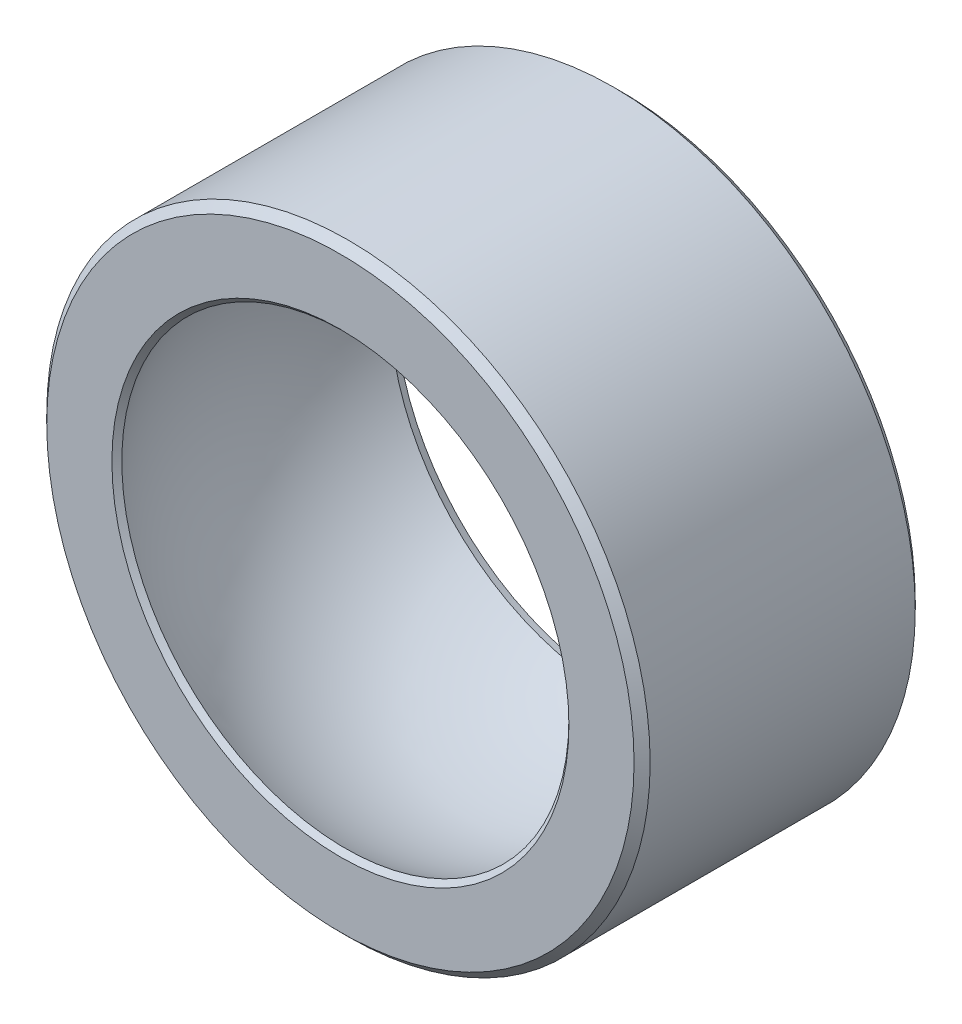
from build123d import *

# Parameters (mm, degrees)
ESTRUSIONE1_DEPTH      = 3.495
ESTRUSIONE1_DEPTH_BACK = 3.495
SCHIZZO1_R             = 7.5
SMUSSO1_SIZE           = 0.2
SMUSSO1_SIZE_2         = 0.14484006


with BuildPart() as part:
    # Schizzo1 → Estrusione1 (new, two sides: drawn at the far end of the back side and taken through both)
    with BuildSketch(Plane.XY.offset(-ESTRUSIONE1_DEPTH_BACK)):
        Circle(SCHIZZO1_R)
    extrude(amount=ESTRUSIONE1_DEPTH + ESTRUSIONE1_DEPTH_BACK)

    # Schizzo2 → Taglia-Rivoluzione1 (revolve, cut)
    with BuildSketch(Plane(origin=(0, 0, 0), x_dir=(1, 0, 0), z_dir=(0, 1, 0))):
        with BuildLine():
            Line((0, 6.5), (0, -6.5))
            ThreePointArc((0, -6.5), (-6.5, 0), (0, 6.5))
        make_face()
    revolve(axis=Axis((0, 0, -4.815448708), (0, 0, 1)), mode=Mode.SUBTRACT)

    # Smusso1
    # the kernel refuses this chamfer: 0.2, 0.14484006 mm, written as the material it takes off along each edge
    with BuildSketch(Plane(origin=(0, 0, -3.495), x_dir=(1, 0, 0), z_dir=(0, -1, 0))) as smusso1_piece_1:
        Polygon((7.5, SMUSSO1_SIZE), (7.5 - SMUSSO1_SIZE, 0), (7.5, 0), align=None)
    revolve(axis=Axis((0, 0, -3.495), (0, 0, 1)), mode=Mode.SUBTRACT)
    with BuildSketch(Plane(origin=(0, 0, 3.495), x_dir=(1, 0, 0), z_dir=(0, -1, 0))) as smusso1_piece_2:
        Polygon((7.5, -SMUSSO1_SIZE), (7.5 - SMUSSO1_SIZE, 0), (7.5, 0), align=None)
    revolve(axis=Axis((0, 0, 3.495), (0, 0, 1)), mode=Mode.SUBTRACT)
    with BuildSketch(Plane(origin=(0, 0, 3.495), x_dir=(-1, 0, 0), z_dir=(0, -1, 0))) as smusso1_piece_3:
        with BuildLine():
            Line((5.480417411 + SMUSSO1_SIZE, 0), (5.557122182, 0.12329523))
            ThreePointArc((5.557122182, 0.12329523), (5.519593752, 0.062204519), (5.480417411, 0))
            Line((5.480417411, 0), (5.480417411 + SMUSSO1_SIZE, 0))
        make_face()
    revolve(axis=Axis((0, 0, 3.495), (0, 0, -1)), mode=Mode.SUBTRACT)
    with BuildSketch(Plane(origin=(0, 0, -3.495), x_dir=(-1, 0, 0), z_dir=(0, -1, 0))) as smusso1_piece_4:
        with BuildLine():
            Line((5.480417411 + SMUSSO1_SIZE_2 * 1.00000000281, 0), (5.586985705, -0.173014037))
            ThreePointArc((5.586985705, -0.173014037), (5.535884344, -0.088537827), (5.480417411, 0))
            Line((5.480417411, 0), (5.480417411 + SMUSSO1_SIZE_2 * 1.00000000281, 0))
        make_face()
    revolve(axis=Axis((0, 0, -3.495), (0, 0, -1)), mode=Mode.SUBTRACT)


solid = part.part
